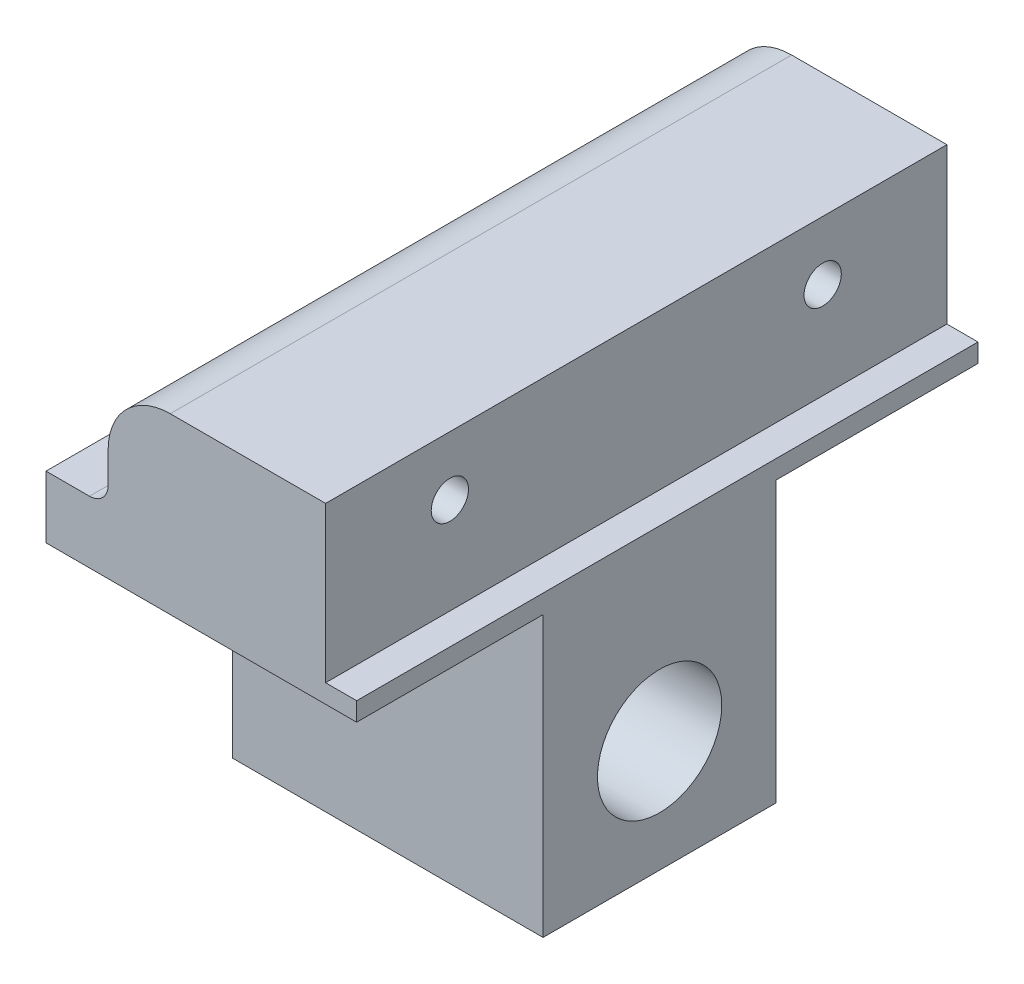
from build123d import *

# Parameters (mm, degrees)
BOSS_EXTRUDE1_DEPTH = 100
SKETCH3_W           = 32.48675427
SKETCH3_H           = 45
CUT_EXTRUDE5_DEPTH  = 120.560658656
SKETCH7_W           = 30
SKETCH7_H           = 45
CUT_EXTRUDE7_DEPTH  = 120.560658656
SKETCH8_R           = 10
CUT_EXTRUDE8_DEPTH  = 120.560658656
SKETCH9_R           = 2.5
CUT_EXTRUDE9_DEPTH  = 13
SKETCH10_R          = 3
CUT_EXTRUDE10_DEPTH = 10
FILLET1_R           = 1
FILLET2_R           = 1
SKETCH11_R          = 2.5
CUT_EXTRUDE11_DEPTH = 13
SKETCH12_R          = 3
CUT_EXTRUDE12_DEPTH = 10
FILLET3_R           = 1


with BuildPart() as part:
    # Sketch2 → Boss-Extrude1 (new body)
    with BuildSketch(Plane.XY):
        with BuildLine():
            Line((-10.655452858, -42.364502809), (39.344547142, -42.364502809))
            Line((39.344547142, -42.364502809), (39.344547142, 2.635497191))
            Line((39.344547142, 2.635497191), (39.344547142, 5.635497191))
            Line((39.344547142, 5.635497191), (34.344547142, 5.635497191))
            Line((34.344547142, 5.635497191), (34.344547142, 30.635497191))
            Line((34.344547142, 30.635497191), (9.344547142, 30.635497191))
            ThreePointArc((9.344547142, 30.635497191), (2.27347933, 27.706565003), (-0.655452858, 20.635497191))
            Line((-0.655452858, 20.635497191), (-0.655452858, 15.635497191))
            ThreePointArc((-0.655452858, 15.635497191), (-1.534132514, 13.514176848), (-3.655452858, 12.635497191))
            Line((-3.655452858, 12.635497191), (-10.655452858, 12.635497191))
            Line((-10.655452858, 12.635497191), (-10.655452858, -42.364502809))
        make_face()
    extrude(amount=BOSS_EXTRUDE1_DEPTH)

    # Sketch3 → Cut-Extrude5 (cut, through all)
    with BuildSketch(Plane(origin=(39.344547142, 0, 0), x_dir=(0, 0, -1), z_dir=(1, 0, 0))):
        with Locations((-16.243377135, -19.864502809)):
            Rectangle(SKETCH3_W, SKETCH3_H)
    extrude(amount=-CUT_EXTRUDE5_DEPTH, mode=Mode.SUBTRACT)

    # Sketch7 → Cut-Extrude7 (cut, through all)
    with BuildSketch(Plane(origin=(39.344547142, 0, 0), x_dir=(0, 0, -1), z_dir=(1, 0, 0))):
        with Locations((-85, -19.864502809)):
            Rectangle(SKETCH7_W, SKETCH7_H)
    extrude(amount=-CUT_EXTRUDE7_DEPTH, mode=Mode.SUBTRACT)

    # Sketch8 → Cut-Extrude8 (cut, through all)
    with BuildSketch(Plane(origin=(39.344547142, 0, 0), x_dir=(0, 0, -1), z_dir=(1, 0, 0))):
        with Locations((-51.243377135, -24.364502809)):
            Circle(SKETCH8_R)
    extrude(amount=-CUT_EXTRUDE8_DEPTH, mode=Mode.SUBTRACT)

    # Sketch9 → Cut-Extrude9 (cut)
    with BuildSketch(Plane(origin=(34.344547142, 0, 0), x_dir=(0, 0, -1), z_dir=(1, 0, 0))):
        with Locations((-20, 21.135497191)):
            Circle(SKETCH9_R)
        with Locations((-80, 21.135497191)):
            Circle(SKETCH9_R)
    extrude(amount=-CUT_EXTRUDE9_DEPTH, mode=Mode.SUBTRACT)

    # Sketch10 → Cut-Extrude10 (cut)
    with BuildSketch(Plane(origin=(34.344547142, 0, 0), x_dir=(0, 0, -1), z_dir=(1, 0, 0))):
        with Locations((-20, 21.135497191)):
            Circle(SKETCH10_R)
        with Locations(Location((-80, 21.135497191, 0), (0, 0, 180))):
            Circle(SKETCH10_R)
    extrude(amount=-CUT_EXTRUDE10_DEPTH, mode=Mode.SUBTRACT)

    # Fillet1
    # the kernel refuses this fillet: 1 mm, written as the material it adds along each edge
    with BuildSketch(Plane(origin=(24.344547142, 21.135497191, 20), x_dir=(0, 0, -1), z_dir=(0, -1, 0))) as fillet1_piece_1:
        with BuildLine():
            CenterArc((2, 0.866025404), FILLET1_R, 300, 60)
            Line((2.5, 0), (2.51, -0.017320508))
            ThreePointArc((2.51, -0.017320508), (2.75, -0.02), (3, -0.02))
            Line((3, -0.02), (3.02, 0))
            Line((3.02, 0), (3.02, 0.866025404))
            Line((3.02, 0.866025404), (3, 0.866025404))
        make_face()
    revolve(axis=Axis((24.344547142, 21.135497191, 20), (1, 0, 0)))

    # Fillet2
    # the kernel refuses this fillet: 1 mm, written as the material it adds along each edge
    with BuildSketch(Plane(origin=(24.344547142, 21.135497191, 80), x_dir=(0, 0, 1), z_dir=(0, 1, 0))) as fillet2_piece_1:
        with BuildLine():
            CenterArc((2, 0.866025404), FILLET2_R, 300, 60)
            Line((2.5, 0), (2.51, -0.017320508))
            ThreePointArc((2.51, -0.017320508), (2.75, -0.02), (3, -0.02))
            Line((3, -0.02), (3.02, 0))
            Line((3.02, 0), (3.02, 0.866025404))
            Line((3.02, 0.866025404), (3, 0.866025404))
        make_face()
    revolve(axis=Axis((24.344547142, 21.135497191, 80), (1, 0, 0)))

    # Sketch11 → Cut-Extrude11 (cut)
    with BuildSketch(Plane.XZ.offset(42.364502809)):
        with Locations(Location((14.344547142, 63.243377135, 0), (0, 0, 270))):
            Circle(SKETCH11_R)
        with Locations(Location((14.344547142, 39.243377135, 0), (0, 0, 270))):
            Circle(SKETCH11_R)
    extrude(amount=-CUT_EXTRUDE11_DEPTH, mode=Mode.SUBTRACT)

    # Sketch12 → Cut-Extrude12 (cut)
    with BuildSketch(Plane.XZ.offset(42.364502809)):
        with Locations(Location((14.344547142, 63.243377135, 0), (0, 0, 270))):
            Circle(SKETCH12_R)
        with Locations(Location((14.344547142, 39.243377135, 0), (0, 0, 90))):
            Circle(SKETCH12_R)
    extrude(amount=-CUT_EXTRUDE12_DEPTH, mode=Mode.SUBTRACT)

    # Fillet3
    # the kernel refuses this fillet: 1 mm, written as the material it adds along each edge
    with BuildSketch(Plane(origin=(14.344547142, -32.364502809, 63.243377135), x_dir=(0, 0, -1), z_dir=(-1, 0, 0))) as fillet3_piece_1:
        with BuildLine():
            CenterArc((2, 0.866025404), FILLET3_R, 300, 60)
            Line((2.5, 0), (2.51, -0.017320508))
            ThreePointArc((2.51, -0.017320508), (2.75, -0.02), (3, -0.02))
            Line((3, -0.02), (3.02, 0))
            Line((3.02, 0), (3.02, 0.866025404))
            Line((3.02, 0.866025404), (3, 0.866025404))
        make_face()
    revolve(axis=Axis((14.344547142, -32.364502809, 63.243377135), (0, -1, 0)))
    with BuildSketch(Plane(origin=(14.344547142, -32.364502809, 39.243377135), x_dir=(0, 0, 1), z_dir=(1, 0, 0))) as fillet3_piece_2:
        with BuildLine():
            CenterArc((2, 0.866025404), FILLET3_R, 300, 60)
            Line((2.5, 0), (2.51, -0.017320508))
            ThreePointArc((2.51, -0.017320508), (2.75, -0.02), (3, -0.02))
            Line((3, -0.02), (3.02, 0))
            Line((3.02, 0), (3.02, 0.866025404))
            Line((3.02, 0.866025404), (3, 0.866025404))
        make_face()
    revolve(axis=Axis((14.344547142, -32.364502809, 39.243377135), (0, -1, 0)))


solid = part.part
